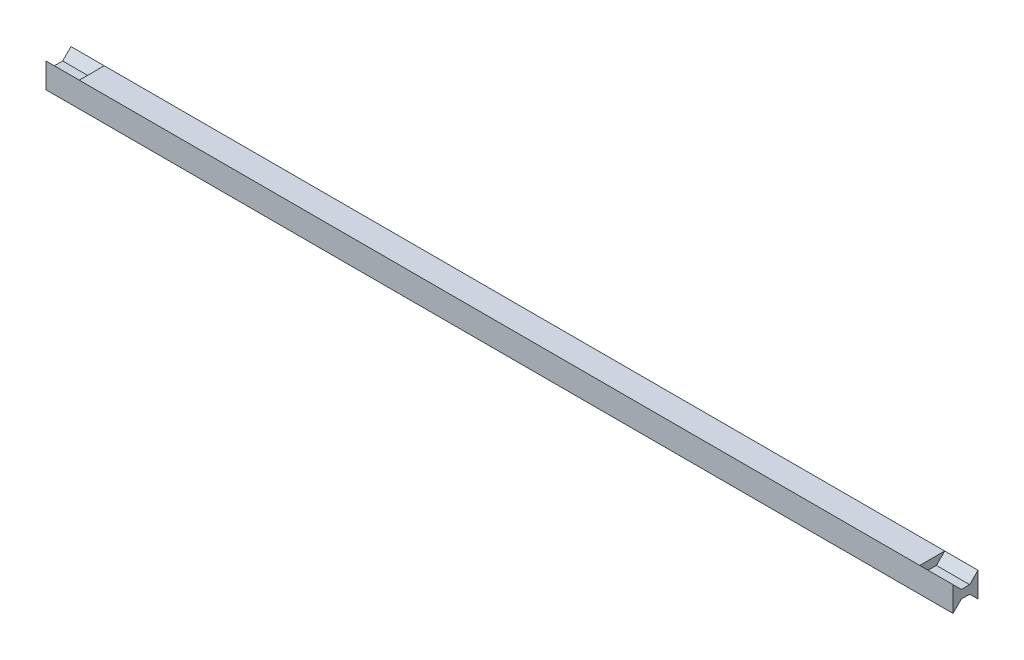
from build123d import *

# Parameters (mm, degrees)
SKICA1_W                = 202
SKICA1_H                = 6
P_IDAT_VYSUNUT_M1_DEPTH = 6
P_IDAT_VYSUNUT_M2_DEPTH = 8
P_IDAT_VYSUNUT_M3_DEPTH = 8


with BuildPart() as part:
    # Skica1 → Přidat vysunutím1 (new body)
    with BuildSketch(Plane(origin=(0, 0, 0), x_dir=(1, 0, 0), z_dir=(0, 1, 0))):
        with Locations((101, 3)):
            Rectangle(SKICA1_W, SKICA1_H)
    extrude(amount=P_IDAT_VYSUNUT_M1_DEPTH)

    # Skica2 → Přidat vysunutím2 (add)
    with BuildSketch(Plane.ZY):
        Polygon((-6, 6), (-6, 0), (-4, 2), (-2, 2), (0, 0), (0, 6), (-2, 4), (-4, 4), align=None)
    extrude(amount=P_IDAT_VYSUNUT_M2_DEPTH)

    # Skica3 → Přidat vysunutím3 (add)
    with BuildSketch(Plane(origin=(202, 0, 0), x_dir=(0, 0, -1), z_dir=(1, 0, 0))):
        Polygon((0, 6), (0, 0), (2, 2), (4, 2), (6, 0), (6, 6), (4, 4), (2, 4), align=None)
    extrude(amount=P_IDAT_VYSUNUT_M3_DEPTH)


solid = part.part
